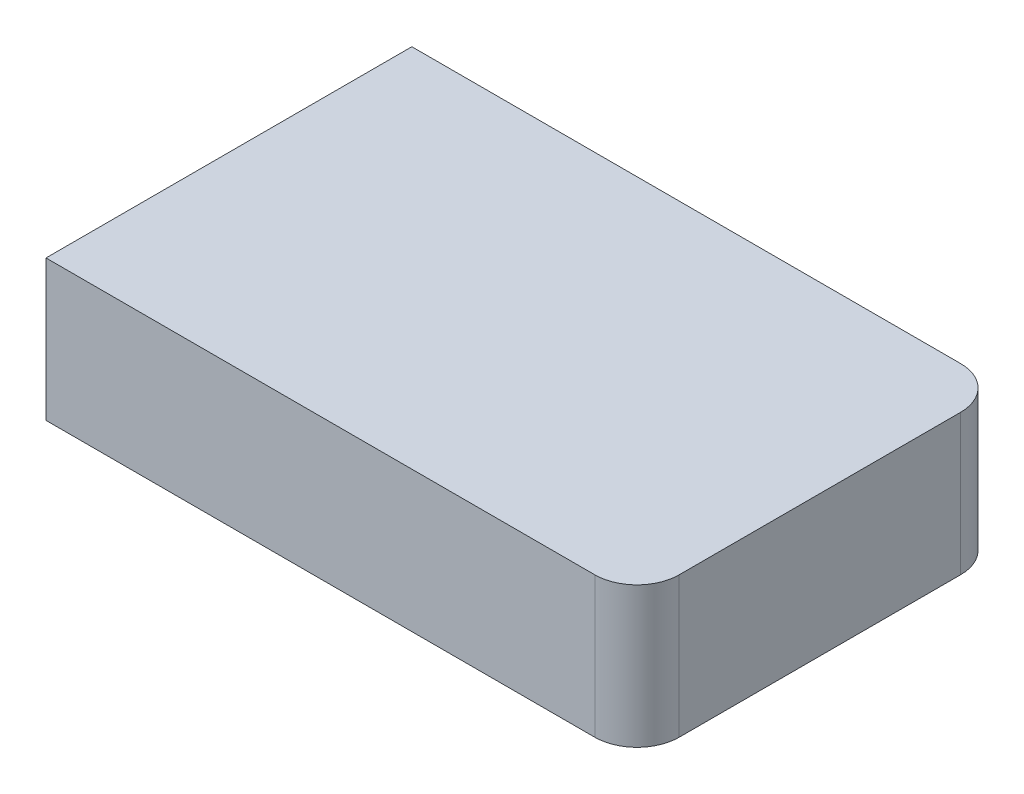
from build123d import *

# Parameters (mm, degrees)
SKETCH_1_W      = 42
SKETCH_1_H      = 26
EXTRUDE_1_DEPTH = 10
FILLET_1_R      = 3


with BuildPart() as part:
    # 草图1 → 凸台-拉伸1 (new body)
    with BuildSketch(Plane(origin=(0, 0, 0), x_dir=(1, 0, 0), z_dir=(0, 1, 0))):
        Rectangle(SKETCH_1_W, SKETCH_1_H)
    extrude(amount=EXTRUDE_1_DEPTH)

    # 圆角1
    fillet_1_edges = [part.edges().sort_by_distance(p)[0] for p in [
        (21, 5, -13),
        (21, 5, 13),
    ]]
    fillet(fillet_1_edges, radius=FILLET_1_R)


solid = part.part
